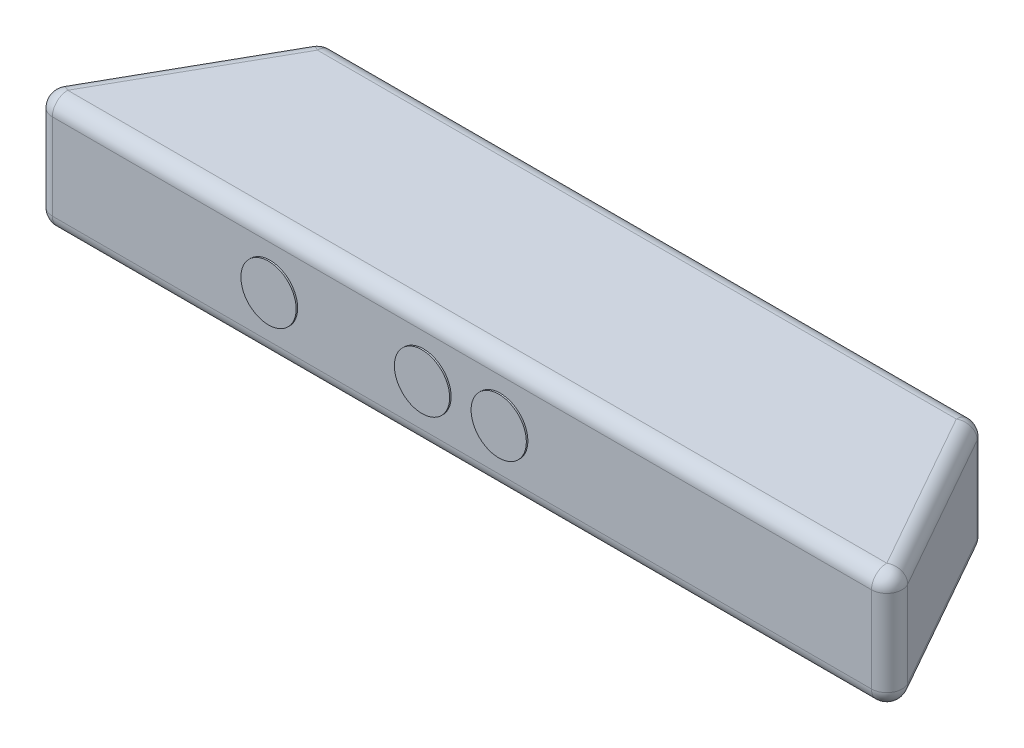
from build123d import *

# Parameters (mm, degrees)
BOSS_EXTRUDE1_DEPTH = 38
BOSS_EXTRUDE2_DEPTH = 10
FILLET1_R           = 5
SKETCH3_R           = 9
CUT_EXTRUDE1_DEPTH  = 5
SKETCH5_R           = 9
BOSS_EXTRUDE3_DEPTH = 0.5
SKETCH6_R           = 3
CUT_EXTRUDE2_DEPTH  = 2.5


with BuildPart() as part:
    # Sketch1 → Boss-Extrude1 (new body)
    with BuildSketch(Plane(origin=(0, 0, 0), x_dir=(1, 0, 0), z_dir=(0, 1, 0))):
        Polygon((-142, 0), (142, 0), (107, 62), (-107, 62), align=None)
    extrude(amount=BOSS_EXTRUDE1_DEPTH)

    # Sketch2 → Boss-Extrude2 (add)
    with BuildSketch(Plane.XZ):
        with BuildLine():
            ThreePointArc((8.5, -31), (0, -35.75), (-8.5, -31))
            ThreePointArc((-8.5, -31), (0, -26.25), (8.5, -31))
        make_face()
    extrude(amount=BOSS_EXTRUDE2_DEPTH)

    # Fillet1
    fillet1_edges = [part.edges().sort_by_distance(p)[0] for p in [
        (-142, 19, 0),
        (-124.5, 38, -31),
        (-107, 19, -62),
        (-124.5, 0, -31),
        (0, 0, -62),
        (0, 38, -62),
        (0, 38, 0),
        (124.5, 38, -31),
        (107, 19, -62),
        (142, 19, 0),
        (124.5, 0, -31),
        (0, 0, 0),
    ]]
    fillet(fillet1_edges, radius=FILLET1_R)

    # Sketch3 → Cut-Extrude1 (cut)
    with BuildSketch(Plane.XY):
        with Locations((12.5, 19)):
            Circle(SKETCH3_R)
        with Locations((-12.5, 19)):
            Circle(SKETCH3_R)
        with Locations((-62.5, 19)):
            Circle(SKETCH3_R)
    extrude(amount=-CUT_EXTRUDE1_DEPTH, mode=Mode.SUBTRACT)

    # Sketch5 → Boss-Extrude3 (add, symmetric)
    with BuildSketch(Plane.XY):
        with Locations((-12.5, 19)):
            Circle(SKETCH5_R)
        with Locations((12.5, 19)):
            Circle(SKETCH5_R)
        with Locations((-62.5, 19)):
            Circle(SKETCH5_R)
    extrude(amount=BOSS_EXTRUDE3_DEPTH, both=True)

    # Sketch6 → Cut-Extrude2 (cut)
    with BuildSketch(Plane.XZ):
        with Locations((-97, -17.5)):
            Circle(SKETCH6_R)
        with Locations((97, -17.5)):
            Circle(SKETCH6_R)
    extrude(amount=-CUT_EXTRUDE2_DEPTH, mode=Mode.SUBTRACT)


solid = part.part
